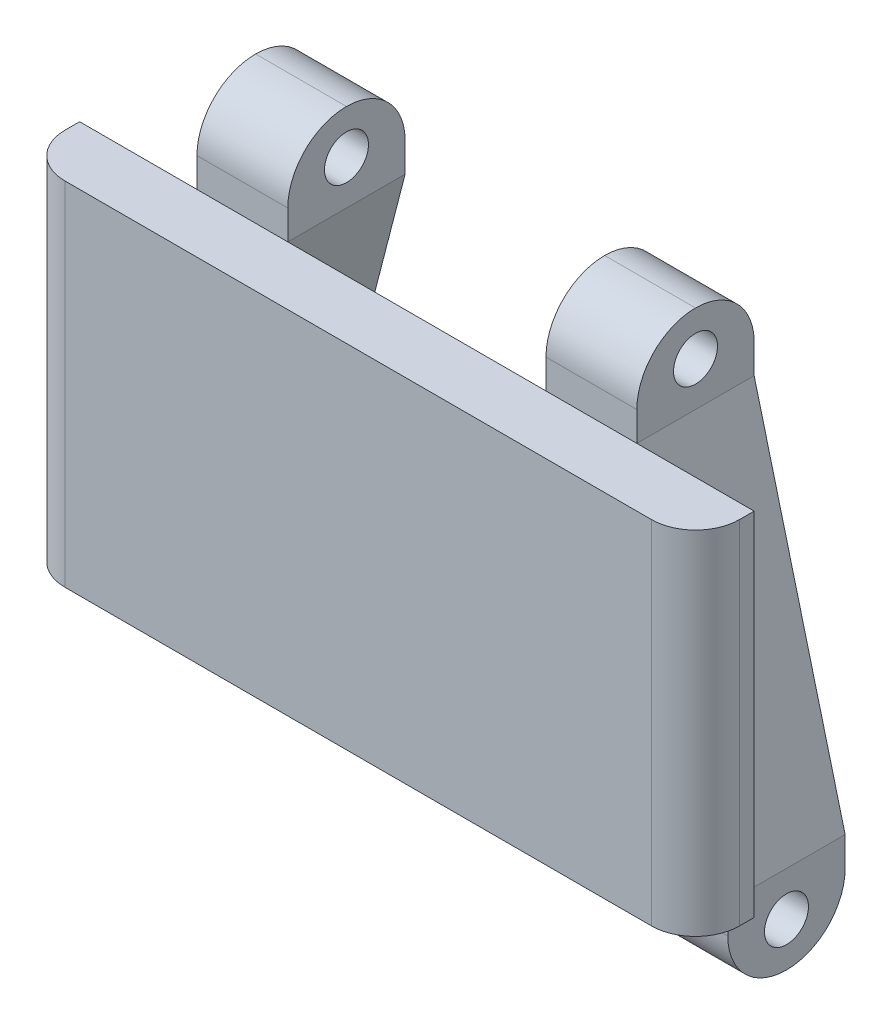
from build123d import *

# Parameters (mm, degrees)
SKETCH2_W                      = 23
SKETCH2_H                      = 12
BOSS_EXTRUDE2_DEPTH            = 2
FILLET3_R                      = 1.5
BOSS_EXTRUDE4_DEPTH            = 4
FILLET4_R                      = 2
F_1_5MM_DOWEL_HOLE1_AT_2_COUNT = 2
F_1_5MM_DOWEL_HOLE1_AT_2_PITCH = 15
F_1_5MM_DOWEL_HOLE2_D          = 1.5
F_1_5MM_DOWEL_HOLE2_DEPTH      = 29999.549354536
F_1_5MM_DOWEL_HOLE2_TIP        = 0.450645464


with BuildPart() as part:
    # Sketch2 → Boss-Extrude2 (new body)
    with BuildSketch(Plane.XY):
        Rectangle(SKETCH2_W, SKETCH2_H)
    extrude(amount=BOSS_EXTRUDE2_DEPTH)

    # Fillet3
    fillet3_edges = [part.edges().sort_by_distance(p)[0] for p in [
        (-11.5, 0, 2),
        (11.5, 0, 2),
    ]]
    fillet(fillet3_edges, radius=FILLET3_R)

    # Sketch3 → Boss-Extrude4 (add)
    with BuildSketch(Plane(origin=(0, 0, 0), x_dir=(-1, 0, 0), z_dir=(0, 0, -1))):
        Polygon((-10.602604408, -6), (-7.5, 6), (-7.5, 9), (-4.401349547, 9), (-4.401349547, 6), (-7.503953954, -6), (-7.503953954, -9), (-10.602604408, -9), align=None)
        Polygon((7.503953954, -6), (4.401349547, 6), (4.401349547, 9), (7.5, 9), (7.5, 6), (10.602604408, -6), (10.602604408, -9), (7.503953954, -9), align=None)
    extrude(amount=BOSS_EXTRUDE4_DEPTH)

    # Fillet4
    fillet4_edges = [part.edges().sort_by_distance(p)[0] for p in [
        (-9.053279181, -9, 0),
        (-9.053279181, -9, -4),
        (9.053279181, -9, 0),
        (9.053279181, -9, -4),
        (5.950674773, 9, 0),
        (5.950674773, 9, -4),
        (-5.950674773, 9, 0),
        (-5.950674773, 9, -4),
    ]]
    fillet(fillet4_edges, radius=FILLET4_R - 0.0001)  # a hair under: the kernel refuses the full size

    # Sketch9 → Ø1.5mm Dowel Hole1 (revolve, cut)
    with BuildSketch(Plane(origin=(7.5, 7.5, -2), x_dir=(0, 0, -1), z_dir=(0, 1, 0))):
        Polygon((0, 0), (0, 30000), (0.75, 29999.549354536), (0.75, 0), align=None)
    f_1_5mm_dowel_hole1 = revolve(axis=Axis((13.85, 7.5, -2), (-1, 0, 0)), mode=Mode.SUBTRACT)

    # Ø1.5mm Dowel Hole1 at 2: Ø1.5mm Dowel Hole1 ×2
    with Locations(*[(0, -i * F_1_5MM_DOWEL_HOLE1_AT_2_PITCH, 0) for i in range(1, F_1_5MM_DOWEL_HOLE1_AT_2_COUNT)]):
        add(f_1_5mm_dowel_hole1, mode=Mode.SUBTRACT)

    # Ø1.5mm Dowel Hole2
    with Locations(Plane(origin=(7.5, -7.5, -2), x_dir=(0, 0, -1), z_dir=(-1, 0, 0))):
        with Locations((0, 0)):
            Hole(F_1_5MM_DOWEL_HOLE2_D / 2, depth=F_1_5MM_DOWEL_HOLE2_DEPTH)
            with Locations((0, 0, -(F_1_5MM_DOWEL_HOLE2_DEPTH + F_1_5MM_DOWEL_HOLE2_TIP / 2))):  # 118° drill point
                Cone(0, F_1_5MM_DOWEL_HOLE2_D / 2, F_1_5MM_DOWEL_HOLE2_TIP, mode=Mode.SUBTRACT)


solid = part.part
